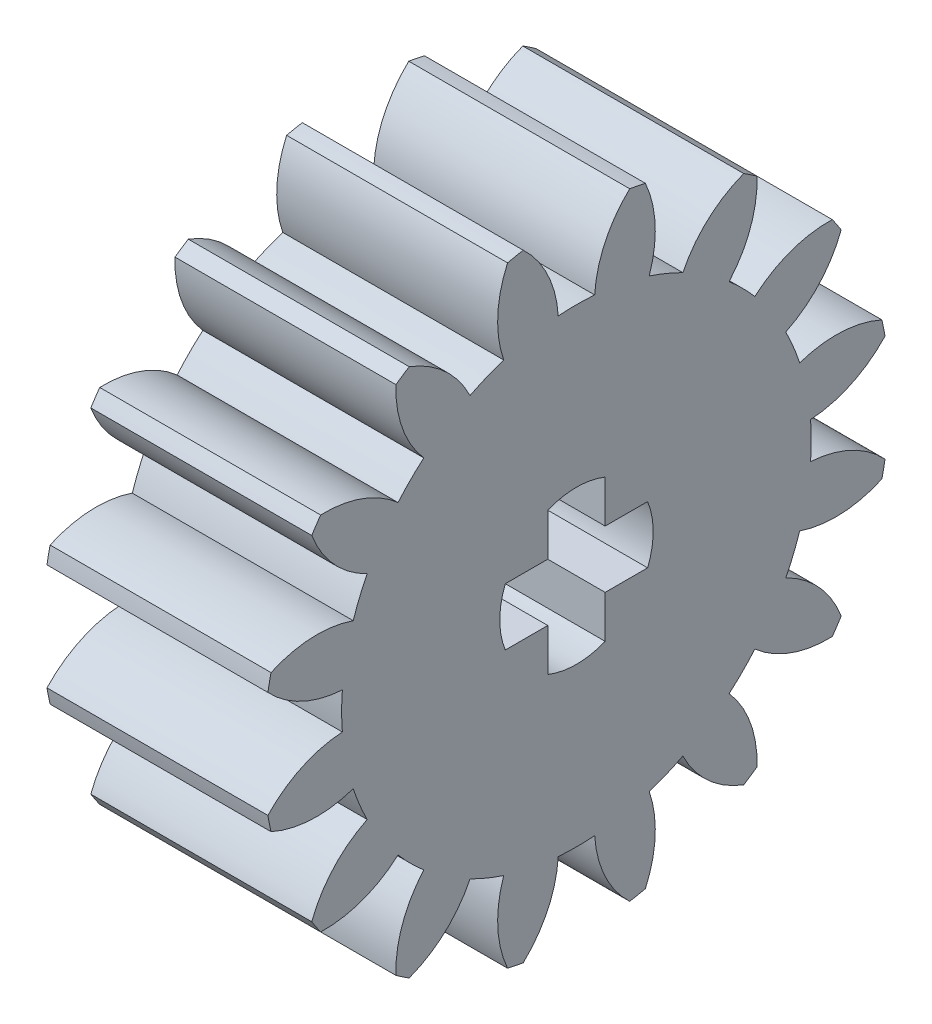
from build123d import *

# Parameters (mm, degrees)
BASPROSKE_W        = 6.35
BASPROSKE_H        = 9
TOOTHCUT_DEPTH     = 15.224011389
TEETHCUTS_COUNT    = 16
TEETHCUTS_ANGLE    = 337.5
BORSKE_R           = 0.5
BORE_DEPTH         = 50.0000508
CUT_EXTRUDE1_DEPTH = 10


with BuildPart() as part:
    # BasProSke → Base-Revolve (revolve)
    with BuildSketch(Plane(origin=(0, 0, 0), x_dir=(1, 0, 0), z_dir=(0, 1, 0))):
        with Locations((3.175, 4.5)):
            Rectangle(BASPROSKE_W, BASPROSKE_H)
    revolve(axis=Axis((-10, 0, 0), (1, 0, 0)))

    # TooCutSke → ToothCut (cut, through all)
    with BuildSketch(Plane(origin=(0, 0, 0), x_dir=(0, 0, -1), z_dir=(1, 0, 0))):
        with BuildLine():
            ThreePointArc((0.523792937, 6.728643397), (0, 6.749), (-0.523792937, 6.728643397))
            ThreePointArc((-0.523792937, 6.728643397), (-0.828704482, 7.90962059), (-1.553355277, 8.890721711))
            ThreePointArc((-1.553355277, 8.890721711), (0, 9.0254), (1.553355277, 8.890721711))
            ThreePointArc((1.553355277, 8.890721711), (0.828704482, 7.90962059), (0.523792937, 6.728643397))
        make_face()
    toothcut = extrude(amount=TOOTHCUT_DEPTH, mode=Mode.SUBTRACT)

    # TeethCuts: ToothCut ×16 about axis
    teethcuts_axis = Axis((-10, 0, 0), (1, 0, 0))
    for i in range(1, TEETHCUTS_COUNT):
        add(toothcut.rotate(teethcuts_axis, i * TEETHCUTS_ANGLE / (TEETHCUTS_COUNT - 1)), mode=Mode.SUBTRACT)

    # BorSke → Bore (cut, symmetric)
    with BuildSketch(Plane(origin=(0, 0, 0), x_dir=(0, 0, -1), z_dir=(1, 0, 0))):
        Circle(BORSKE_R)
    extrude(amount=BORE_DEPTH, both=True, mode=Mode.SUBTRACT)

    # Sketch1 → Cut-Extrude1 (cut)
    with BuildSketch(Plane(origin=(6.35, 0, 0), x_dir=(0, 0, -1), z_dir=(1, 0, 0))):
        with BuildLine():
            ThreePointArc((0.824891111, 2.044891111), (0, 2.205), (-0.824891111, 2.044891111))
            Line((-0.824891111, 2.044891111), (-0.824891111, 0.824891111))
            Line((-0.824891111, 0.824891111), (-2.044891111, 0.824891111))
            ThreePointArc((-2.044891111, 0.824891111), (-2.205, 0), (-2.044891111, -0.824891111))
            Line((-2.044891111, -0.824891111), (-0.824891111, -0.824891111))
            Line((-0.824891111, -0.824891111), (-0.824891111, -2.044891111))
            ThreePointArc((-0.824891111, -2.044891111), (0, -2.205), (0.824891111, -2.044891111))
            Line((0.824891111, -2.044891111), (0.824891111, -0.824891111))
            Line((0.824891111, -0.824891111), (2.044891111, -0.824891111))
            ThreePointArc((2.044891111, -0.824891111), (2.164602723, -0.420142893), (2.205, 0))
            ThreePointArc((2.205, 0), (2.164602723, 0.420142893), (2.044891111, 0.824891111))
            Line((2.044891111, 0.824891111), (0.824891111, 0.824891111))
            Line((0.824891111, 0.824891111), (0.824891111, 2.044891111))
        make_face()
    extrude(amount=-CUT_EXTRUDE1_DEPTH, mode=Mode.SUBTRACT)


solid = part.part
